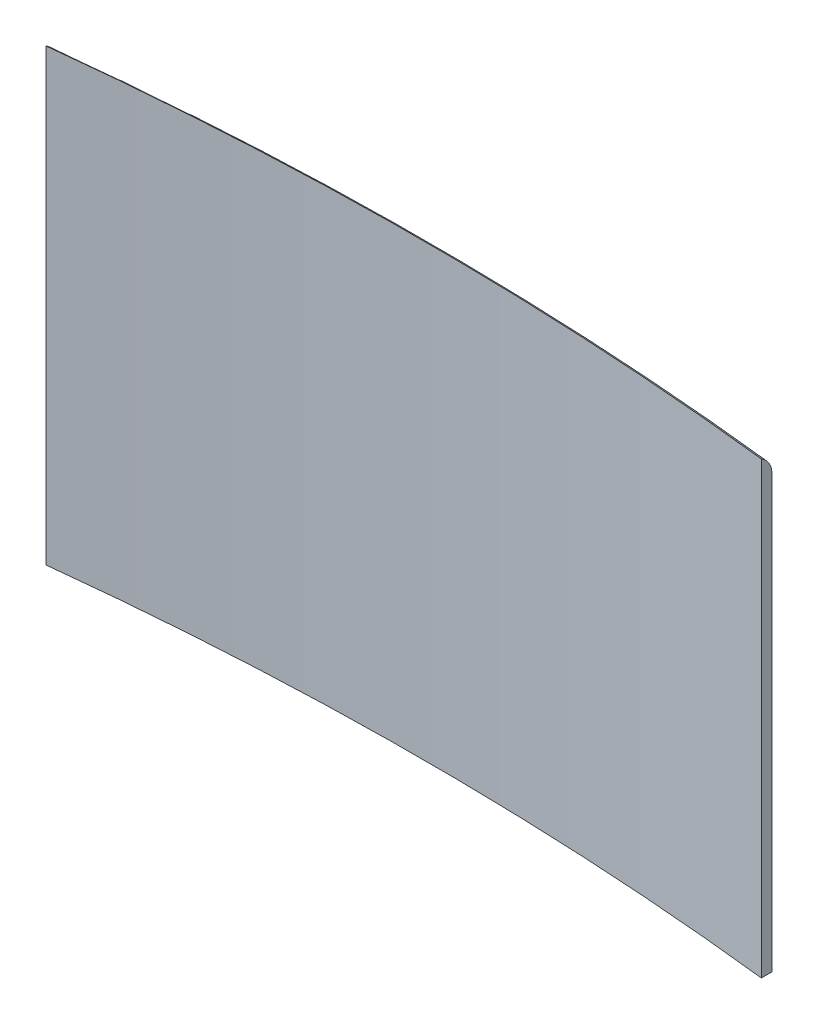
from build123d import *

# Parameters (mm, degrees)
BOSS_EXTRUDE1_DEPTH = 42.73
FILLET1_R           = 2


with BuildPart() as part:
    # Sketch1 → Boss-Extrude1 (new body)
    with BuildSketch(Plane(origin=(0, 0, 0), x_dir=(1, 0, 0), z_dir=(0, 1, 0))):
        with BuildLine():
            Line((0, 0), (0, 1.01))
            ThreePointArc((0, 1.01), (-34, 2.910983164), (-68, 1.01))
            Line((-68, 1.01), (-68, 0))
            ThreePointArc((-68, 0), (-34, 1.907298996), (0, 0))
        make_face()
    extrude(amount=BOSS_EXTRUDE1_DEPTH)

    # Fillet1
    # the kernel refuses this fillet: 2 mm, written as the material it takes off along each edge
    with BuildSketch(Plane(origin=(-34, 42.73, 302.092701004), x_dir=(0.12558820580413357, 0, -0.9920824575421635), z_dir=(0.9920824575421635, 0, 0.12558820580413357))) as fillet1_piece_1:
        with BuildLine():
            CenterArc((303.003684168, -1.734172645), FILLET1_R, 0, 60.121796646)
            Line((304, 0), (304.019926317, 0.034683453))
            ThreePointArc((304.019926317, 0.034683453), (304.501842084, 0.04), (305.003684168, 0.04))
            Line((305.003684168, 0.04), (305.043684168, 0))
            Line((305.043684168, 0), (305.043684168, -1.734172645))
            Line((305.043684168, -1.734172645), (305.003684168, -1.734172645))
        make_face()
    revolve(axis=Axis((-34, 42.73, 302.092701004), (0, 1, 0)), revolution_arc=14.429450366, mode=Mode.SUBTRACT)


solid = part.part
